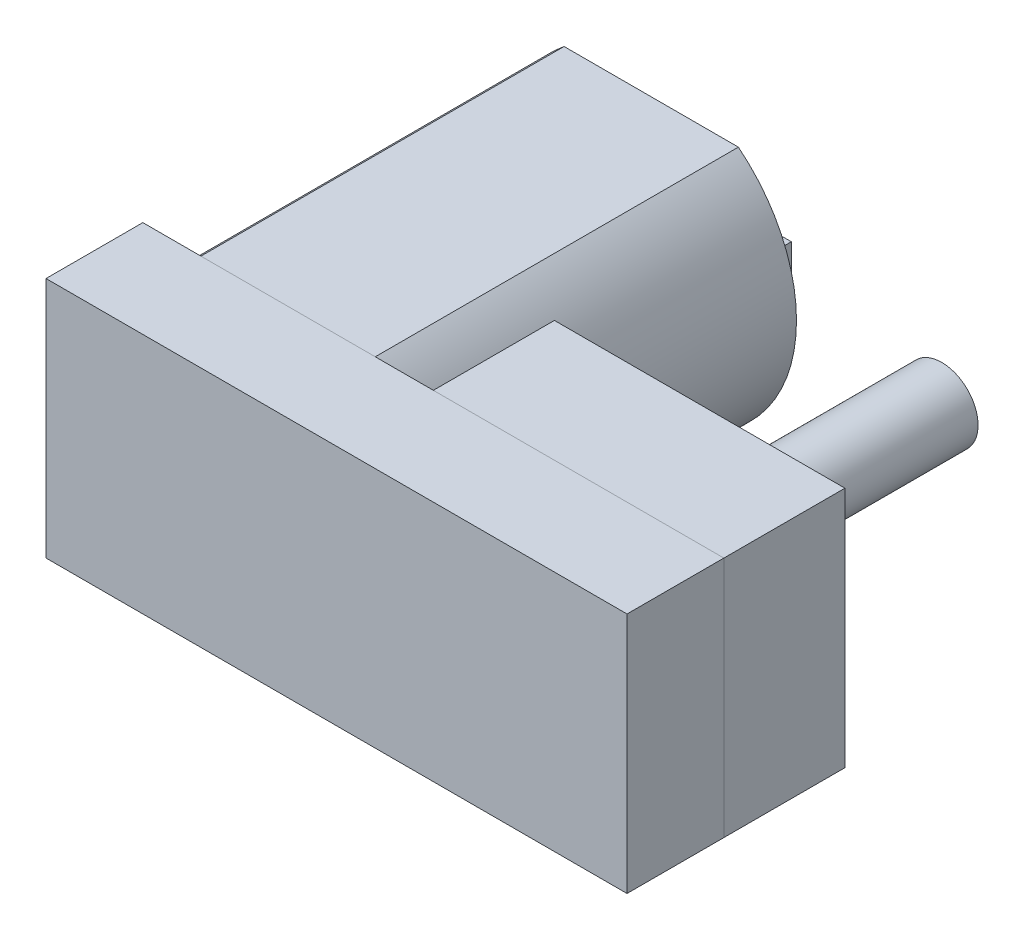
from build123d import *

# Parameters (mm, degrees)
SKETCH_1_W                   = 24
SKETCH_1_H                   = 10
EXTRUDE_1_DEPTH              = 4
EXTRUDE_2_DEPTH              = 15
SKETCH_3_W                   = 0.5
SKETCH_3_H                   = 2.848061163
EXTRUDE_1_2_DEPTH            = 1.8
SKETCH_4_R                   = 1.223700811
EXTRUDE_3_DEPTH              = 1.8
SKETCH_5_W                   = 12
SKETCH_5_H                   = 10
EXTRUDE_4_DEPTH              = 5
SKETCH_6_R                   = 1.5
EXTRUDE_5_DEPTH              = 10
HOLE_START                   = -9
HOLE_WIZARD_M1_6_1_OUTLINE_R = 0.625
HOLE_WIZARD_M1_6_1_DEPTH     = 5.001


# Read off the part's stored shape, not the designer's step: M1.6 螺纹孔1
with BuildPart() as part:
    # 草图1 → Extrude 1 (new body)
    with BuildSketch(Plane.XY):
        with Locations((12, 5)):
            Rectangle(SKETCH_1_W, SKETCH_1_H)
    extrude(amount=-EXTRUDE_1_DEPTH)


with BuildPart() as body_2:
    # 草图2 → 凸台-拉伸2 (new body)
    with BuildSketch(Plane(origin=(0, 0, -4), x_dir=(-1, 0, 0), z_dir=(0, 0, -1))):
        with BuildLine():
            Line((-9.6, 0), (-2.4, 0))
            ThreePointArc((-2.4, 0), (0, 5), (-2.4, 10))
            Line((-2.4, 10), (-9.6, 10))
            ThreePointArc((-9.6, 10), (-12, 5), (-9.6, 0))
        make_face()
    extrude(amount=EXTRUDE_2_DEPTH)

    # 草图3 → Extrude 1 2 (add)
    with BuildSketch(Plane(origin=(0, 0, -19), x_dir=(-1, 0, 0), z_dir=(0, 0, -1))):
        with Locations((-9.736566452, 4.48522879)):
            Rectangle(SKETCH_3_W, SKETCH_3_H)
        with Locations((-2.310898304, 4.48522879)):
            Rectangle(SKETCH_3_W, SKETCH_3_H)
    extrude(amount=EXTRUDE_1_2_DEPTH)

    # 草图4 → 凸台-拉伸3 (add)
    with BuildSketch(Plane(origin=(0, 0, -19), x_dir=(-1, 0, 0), z_dir=(0, 0, -1))):
        with Locations((-6.056056762, 4.515848892)):
            Circle(SKETCH_4_R)
    extrude(amount=EXTRUDE_3_DEPTH)


with BuildPart() as body_3:
    # 草图5 → 凸台-拉伸4 (new body)
    with BuildSketch(Plane(origin=(0, 0, -4), x_dir=(-1, 0, 0), z_dir=(0, 0, -1))):
        with Locations((-18, 5)):
            Rectangle(SKETCH_5_W, SKETCH_5_H)
    extrude(amount=EXTRUDE_4_DEPTH)


with BuildPart() as body_4:
    # 草图6 → 凸台-拉伸5 (new body)
    with BuildSketch(Plane(origin=(0, 0, -9), x_dir=(-1, 0, 0), z_dir=(0, 0, -1))):
        with Locations((-18, 5)):
            Circle(SKETCH_6_R)
    extrude(amount=EXTRUDE_5_DEPTH)


with BuildPart() as hole_wizard_m1_6_1_tool:
    # M1.6 螺纹孔1 outline → M1.6 螺纹孔1 (new body)
    with BuildSketch(Plane.XY.offset(HOLE_START)):
        with Locations((13.5, 5)):
            Circle(HOLE_WIZARD_M1_6_1_OUTLINE_R)
        with Locations((22.5, 5)):
            Circle(HOLE_WIZARD_M1_6_1_OUTLINE_R)
    extrude(amount=HOLE_WIZARD_M1_6_1_DEPTH)


with BuildPart() as part_1:
    add(part.part)

    # M1.6 螺纹孔1: cut by hole_wizard_m1_6_1_tool
    add(hole_wizard_m1_6_1_tool.part, mode=Mode.SUBTRACT)


with BuildPart() as body_3_1:
    add(body_3.part)

    # M1.6 螺纹孔1: cut by hole_wizard_m1_6_1_tool
    add(hole_wizard_m1_6_1_tool.part, mode=Mode.SUBTRACT)


solid = Compound([body_2.part, body_4.part, part_1.part, body_3_1.part])
